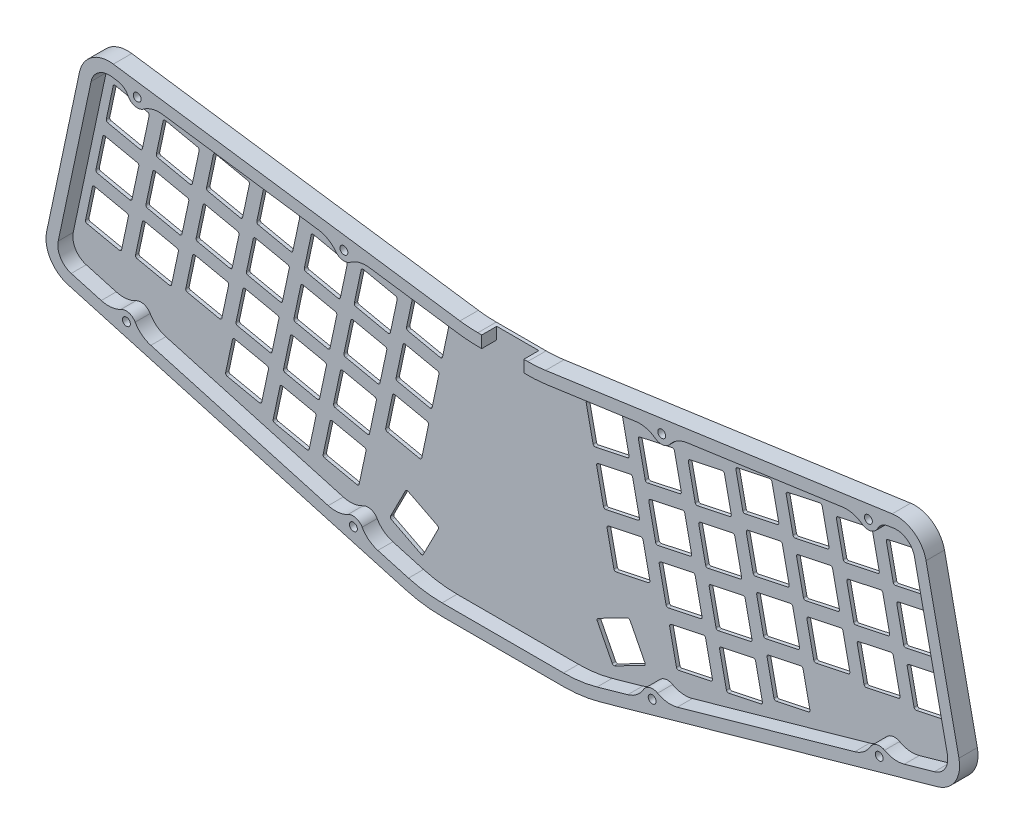
from build123d import *

# Parameters (mm, degrees)
MODEL_R             = 1.5
BOSS_EXTRUDE1_DEPTH = 7
BOSS_EXTRUDE2_DEPTH = 1.3
MODEL_4_R           = 1.5
BOSS_EXTRUDE3_DEPTH = 2
CUT_EXTRUDE1_DEPTH  = 10


with BuildPart() as part:
    # Model → Boss-Extrude1 (new body)
    with BuildSketch(Plane.XY):
        with BuildLine():
            ThreePointArc((176.403737975, 57.612801897), (173.012294783, 57.253677545), (169.603999044, 57.1337718))
            Line((169.603999044, 57.1337718), (150.648829756, 57.1337718))
            ThreePointArc((150.648829756, 57.1337718), (147.240534017, 57.253677545), (143.849090824, 57.612801897))
            Line((143.849090824, 57.612801897), (12.081352867, 76.271030157))
            ThreePointArc((12.081352867, 76.271030157), (3.877804033, 74.308284837), (-0.779653775, 67.275599046))
            Line((-0.779653775, 67.275599046), (-13.274730709, 8.490883588))
            ThreePointArc((-13.274730709, 8.490883588), (-11.871459071, 0.157038619), (-5.151125733, -4.967340667))
            Line((-5.151125733, -4.967340667), (123.055393281, -41.169431628))
            ThreePointArc((123.055393281, -41.169431628), (129.986107868, -42.620640598), (137.050372447, -43.1074446))
            Line((137.050372447, -43.1074446), (183.202456353, -43.1074446))
            ThreePointArc((183.202456353, -43.1074446), (190.266720932, -42.620640598), (197.197435519, -41.169431628))
            Line((197.197435519, -41.169431628), (325.403954533, -4.967340667))
            ThreePointArc((325.403954533, -4.967340667), (332.124287871, 0.157038619), (333.527559509, 8.490883588))
            Line((333.527559509, 8.490883588), (321.032482575, 67.275599045))
            ThreePointArc((321.032482575, 67.275599045), (316.375024767, 74.308284836), (308.171475933, 76.271030156))
            Line((308.171475933, 76.271030156), (176.403737975, 57.612801897))
        make_face()
        with Locations((103.335575354, -30.405568574)):
            Circle(MODEL_R, mode=Mode.SUBTRACT)
        with Locations((17.039281052, -6.037803815)):
            Circle(MODEL_R, mode=Mode.SUBTRACT)
        with Locations((216.917253446, -30.405568574)):
            Circle(MODEL_R, mode=Mode.SUBTRACT)
        with Locations((303.213547748, -6.037803815)):
            Circle(MODEL_R, mode=Mode.SUBTRACT)
        with Locations((21.146353911, 69.937554571)):
            Circle(MODEL_R, mode=Mode.SUBTRACT)
        with Locations((99.718342652, 58.811810716)):
            Circle(MODEL_R, mode=Mode.SUBTRACT)
        with BuildLine():
            Line((124.278255538, -36.838772567), (112.628950613, -33.549320519))
            ThreePointArc((112.628950613, -33.549320519), (109.193120681, -31.80832864), (106.670193349, -28.897861715))
            ThreePointArc((106.670193349, -28.897861715), (104.286690443, -27.037278193), (101.282051153, -27.376394512))
            ThreePointArc((101.282051153, -27.376394512), (97.609446415, -28.537408934), (93.770452927, -28.224185309))
            Line((93.770452927, -28.224185309), (26.332656311, -9.18155576))
            ThreePointArc((26.332656311, -9.18155576), (22.896826379, -7.440563881), (20.373899046, -4.530096956))
            ThreePointArc((20.373899046, -4.530096956), (17.99039614, -2.669513434), (14.98575685, -3.008629753))
            ThreePointArc((14.98575685, -3.008629753), (11.313152113, -4.169644175), (7.474158624, -3.85642055))
            Line((7.474158624, -3.85642055), (-3.928263476, -0.636681606))
            ThreePointArc((-3.928263476, -0.636681606), (-8.01890116, 2.482505785), (-8.873066505, 7.555280983))
            Line((-8.873066505, 7.555280983), (3.622010429, 66.339996442))
            ThreePointArc((3.622010429, 66.339996442), (6.456984747, 70.620761706), (11.450449255, 71.815476249))
            Line((11.450449255, 71.815476249), (13.807051559, 71.481782855))
            ThreePointArc((13.807051559, 71.481782855), (16.05801748, 70.566743382), (17.611829082, 68.698638909))
            ThreePointArc((17.611829082, 68.698638909), (20.250303311, 66.551050421), (23.587647853, 67.21121251))
            ThreePointArc((23.587647853, 67.21121251), (27.071325394, 68.854371308), (30.917639732, 69.058934404))
            Line((30.917639732, 69.058934404), (90.087257633, 60.680553975))
            ThreePointArc((90.087257633, 60.680553975), (93.725570339, 59.416172428), (96.616102068, 56.870429634))
            ThreePointArc((96.616102068, 56.870429634), (99.227639842, 55.346379898), (102.159636594, 56.085468655))
            ThreePointArc((102.159636594, 56.085468655), (105.643314135, 57.728627453), (109.489628473, 57.933190549))
            Line((109.489628473, 57.933190549), (143.218187212, 53.157247988))
            ThreePointArc((143.218187212, 53.157247988), (146.924300392, 52.76480282), (150.648829756, 52.6337718))
            Line((150.648829756, 52.6337718), (169.603999044, 52.6337718))
            ThreePointArc((169.603999044, 52.6337718), (173.328528408, 52.76480282), (177.034641588, 53.157247988))
            Line((177.034641588, 53.157247988), (210.763200327, 57.933190549))
            ThreePointArc((210.763200327, 57.933190549), (214.609514665, 57.728627453), (218.093192206, 56.085468655))
            ThreePointArc((218.093192206, 56.085468655), (221.025188958, 55.346379898), (223.636726732, 56.870429634))
            ThreePointArc((223.636726732, 56.870429634), (226.52725846, 59.416172428), (230.165571167, 60.680553974))
            Line((230.165571167, 60.680553974), (289.335189068, 69.058934403))
            ThreePointArc((289.335189068, 69.058934403), (293.181503406, 68.854371307), (296.665180948, 67.211212509))
            ThreePointArc((296.665180948, 67.211212509), (300.002525489, 66.55105042), (302.640999718, 68.698638908))
            ThreePointArc((302.640999718, 68.698638908), (304.19481132, 70.566743381), (306.445777241, 71.481782853))
            Line((306.445777241, 71.481782853), (308.802379545, 71.815476247))
            ThreePointArc((308.802379545, 71.815476247), (313.795844053, 70.620761705), (316.630818371, 66.339996441))
            Line((316.630818371, 66.339996441), (329.125895305, 7.555280983))
            ThreePointArc((329.125895305, 7.555280983), (328.27172996, 2.482505785), (324.181092276, -0.636681606))
            Line((324.181092276, -0.636681606), (312.778670176, -3.85642055))
            ThreePointArc((312.778670176, -3.85642055), (308.939676687, -4.169644175), (305.26707195, -3.008629753))
            ThreePointArc((305.26707195, -3.008629753), (302.26243266, -2.669513434), (299.878929754, -4.530096956))
            ThreePointArc((299.878929754, -4.530096956), (297.356002421, -7.440563881), (293.920172489, -9.18155576))
            Line((293.920172489, -9.18155576), (226.482375873, -28.224185309))
            ThreePointArc((226.482375873, -28.224185309), (222.643382385, -28.537408934), (218.970777647, -27.376394512))
            ThreePointArc((218.970777647, -27.376394512), (215.966138357, -27.037278193), (213.582635451, -28.897861715))
            ThreePointArc((213.582635451, -28.897861715), (211.059708119, -31.80832864), (207.623878187, -33.549320519))
            Line((207.623878187, -33.549320519), (195.974573262, -36.838772567))
            ThreePointArc((195.974573262, -36.838772567), (189.649455095, -38.16317687), (183.202456353, -38.6074446))
            Line((183.202456353, -38.6074446), (137.050372447, -38.6074446))
            ThreePointArc((137.050372447, -38.6074446), (130.603373705, -38.16317687), (124.278255538, -36.838772567))
        make_face(mode=Mode.SUBTRACT)
        with Locations((220.534486148, 58.811810716)):
            Circle(MODEL_R, mode=Mode.SUBTRACT)
        with Locations((299.10647489, 69.93755457)):
            Circle(MODEL_R, mode=Mode.SUBTRACT)
    extrude(amount=BOSS_EXTRUDE1_DEPTH)

    # Model<3> → Boss-Extrude2 (add)
    with BuildSketch(Plane.XY):
        with BuildLine():
            ThreePointArc((106.670193349, -28.897861715), (109.193120681, -31.80832864), (112.628950613, -33.549320519))
            Line((112.628950613, -33.549320519), (124.278255538, -36.838772567))
            ThreePointArc((124.278255538, -36.838772567), (130.603373705, -38.16317687), (137.050372447, -38.6074446))
            Line((137.050372447, -38.6074446), (160.1264144, -38.6074446))
            Line((160.1264144, -38.6074446), (183.202456353, -38.6074446))
            ThreePointArc((183.202456353, -38.6074446), (189.649455095, -38.16317687), (195.974573262, -36.838772567))
            Line((195.974573262, -36.838772567), (207.623878187, -33.549320519))
            ThreePointArc((207.623878187, -33.549320519), (211.059708119, -31.80832864), (213.582635451, -28.897861715))
            ThreePointArc((213.582635451, -28.897861715), (215.966138357, -27.037278193), (218.970777647, -27.376394512))
            ThreePointArc((218.970777647, -27.376394512), (222.643382385, -28.537408934), (226.482375873, -28.224185309))
            Line((226.482375873, -28.224185309), (271.948963849, -15.385637267))
            Line((271.948963849, -15.385637267), (293.920172489, -9.18155576))
            ThreePointArc((293.920172489, -9.18155576), (297.356002421, -7.440563881), (299.878929754, -4.530096956))
            ThreePointArc((299.878929754, -4.530096956), (302.26243266, -2.669513434), (305.26707195, -3.008629753))
            ThreePointArc((305.26707195, -3.008629753), (308.939676687, -4.169644175), (312.778670176, -3.85642055))
            Line((312.778670176, -3.85642055), (324.181092276, -0.636681606))
            ThreePointArc((324.181092276, -0.636681606), (328.27172996, 2.482505785), (329.125895305, 7.555280983))
            Line((329.125895305, 7.555280983), (322.378197452, 39.30070363))
            Line((322.378197452, 39.30070363), (316.630818371, 66.339996441))
            ThreePointArc((316.630818371, 66.339996441), (313.795844053, 70.620761705), (308.802379545, 71.815476247))
            Line((308.802379545, 71.815476247), (306.445777241, 71.481782853))
            ThreePointArc((306.445777241, 71.481782853), (304.19481132, 70.566743381), (302.640999718, 68.698638908))
            ThreePointArc((302.640999718, 68.698638908), (300.002525489, 66.55105042), (296.665180948, 67.211212509))
            ThreePointArc((296.665180948, 67.211212509), (293.181503406, 68.854371307), (289.335189068, 69.058934403))
            Line((289.335189068, 69.058934403), (230.165571167, 60.680553974))
            ThreePointArc((230.165571167, 60.680553974), (226.52725846, 59.416172428), (223.636726732, 56.870429634))
            ThreePointArc((223.636726732, 56.870429634), (221.025188958, 55.346379898), (218.093192206, 56.085468655))
            ThreePointArc((218.093192206, 56.085468655), (214.609514665, 57.728627453), (210.763200327, 57.933190549))
            Line((210.763200327, 57.933190549), (177.034641588, 53.157247988))
            ThreePointArc((177.034641588, 53.157247988), (173.328528408, 52.76480282), (169.603999044, 52.6337718))
            Line((169.603999044, 52.6337718), (150.648829756, 52.6337718))
            ThreePointArc((150.648829756, 52.6337718), (146.924300392, 52.76480282), (143.218187212, 53.157247988))
            Line((143.218187212, 53.157247988), (109.489628473, 57.933190549))
            ThreePointArc((109.489628473, 57.933190549), (105.643314135, 57.728627453), (102.159636594, 56.085468655))
            ThreePointArc((102.159636594, 56.085468655), (99.227639842, 55.346379898), (96.616102068, 56.870429634))
            ThreePointArc((96.616102068, 56.870429634), (93.725570339, 59.416172428), (90.087257633, 60.680553975))
            Line((90.087257633, 60.680553975), (30.917639732, 69.058934404))
            ThreePointArc((30.917639732, 69.058934404), (27.071325394, 68.854371308), (23.587647853, 67.21121251))
            ThreePointArc((23.587647853, 67.21121251), (20.250303311, 66.551050421), (17.611829082, 68.698638909))
            ThreePointArc((17.611829082, 68.698638909), (16.05801748, 70.566743382), (13.807051559, 71.481782855))
            Line((13.807051559, 71.481782855), (11.450449255, 71.815476249))
            ThreePointArc((11.450449255, 71.815476249), (6.456984747, 70.620761706), (3.622010429, 66.339996442))
            Line((3.622010429, 66.339996442), (-2.125368652, 39.30070363))
            Line((-2.125368652, 39.30070363), (-8.873066505, 7.555280983))
            ThreePointArc((-8.873066505, 7.555280983), (-8.01890116, 2.482505785), (-3.928263476, -0.636681606))
            Line((-3.928263476, -0.636681606), (7.474158624, -3.85642055))
            ThreePointArc((7.474158624, -3.85642055), (11.313152113, -4.169644175), (14.98575685, -3.008629753))
            ThreePointArc((14.98575685, -3.008629753), (17.99039614, -2.669513434), (20.373899046, -4.530096956))
            ThreePointArc((20.373899046, -4.530096956), (22.896826379, -7.440563881), (26.332656311, -9.18155576))
            Line((26.332656311, -9.18155576), (48.303864951, -15.385637267))
            Line((48.303864951, -15.385637267), (93.770452927, -28.224185309))
            ThreePointArc((93.770452927, -28.224185309), (97.609446415, -28.537408934), (101.282051153, -27.376394512))
            ThreePointArc((101.282051153, -27.376394512), (104.286690443, -27.037278193), (106.670193349, -28.897861715))
        make_face()
        with BuildLine():
            ThreePointArc((88.727862955, -5.824846865), (89.052994379, -5.351777707), (89.617407423, -5.247169932))
            Line((89.617407423, -5.247169932), (101.844252435, -7.846066055))
            ThreePointArc((101.844252435, -7.846066055), (102.317321593, -8.171197479), (102.421929368, -8.735610523))
            Line((102.421929368, -8.735610523), (99.823033245, -20.962455535))
            ThreePointArc((99.823033245, -20.962455535), (99.497901821, -21.435524693), (98.933488777, -21.540132468))
            Line((98.933488777, -21.540132468), (86.706643765, -18.941236345))
            ThreePointArc((86.706643765, -18.941236345), (86.233574607, -18.616104921), (86.128966832, -18.051691877))
            Line((86.128966832, -18.051691877), (88.727862955, -5.824846865))
        make_face(mode=Mode.SUBTRACT)
        with BuildLine():
            Line((123.222791405, -32.202255303), (117.65400063, -29.364814683))
            Line((117.65400063, -29.364814683), (112.08520985, -26.527374062))
            ThreePointArc((112.08520985, -26.527374062), (111.712410337, -26.090881916), (111.75744783, -25.518626297))
            Line((111.75744783, -25.518626297), (117.432329033, -14.381044722))
            ThreePointArc((117.432329033, -14.381044722), (117.86882118, -14.008245208), (118.441076802, -14.053282701))
            Line((118.441076802, -14.053282701), (129.578658358, -19.728163942))
            ThreePointArc((129.578658358, -19.728163942), (129.95145787, -20.164656088), (129.906420378, -20.736911707))
            Line((129.906420378, -20.736911707), (124.231539174, -31.874493282))
            ThreePointArc((124.231539174, -31.874493282), (123.795047027, -32.247292796), (123.222791405, -32.202255303))
        make_face(mode=Mode.SUBTRACT)
        with BuildLine():
            ThreePointArc((51.662209955, 2.564871135), (51.987341379, 3.037940293), (52.551754423, 3.142548068))
            Line((52.551754423, 3.142548068), (64.778599435, 0.543651945))
            ThreePointArc((64.778599435, 0.543651945), (65.251668593, 0.218520521), (65.356276368, -0.345892523))
            Line((65.356276368, -0.345892523), (62.757380245, -12.572737535))
            ThreePointArc((62.757380245, -12.572737535), (62.432248821, -13.045806693), (61.867835777, -13.150414468))
            Line((61.867835777, -13.150414468), (49.640990765, -10.551518345))
            ThreePointArc((49.640990765, -10.551518345), (49.167921607, -10.226386921), (49.063313832, -9.661973877))
            Line((49.063313832, -9.661973877), (51.662209955, 2.564871135))
        make_face(mode=Mode.SUBTRACT)
        with BuildLine():
            ThreePointArc((17.403364705, 24.159581835), (17.728496129, 24.632650993), (18.292909173, 24.737258768))
            Line((18.292909173, 24.737258768), (30.519754185, 22.138362645))
            ThreePointArc((30.519754185, 22.138362645), (30.992823343, 21.813231221), (31.097431118, 21.248818177))
            Line((31.097431118, 21.248818177), (28.498534995, 9.021973165))
            ThreePointArc((28.498534995, 9.021973165), (28.173403571, 8.548904007), (27.608990527, 8.444296232))
            Line((27.608990527, 8.444296232), (15.382145515, 11.043192355))
            ThreePointArc((15.382145515, 11.043192355), (14.909076357, 11.368323779), (14.804468582, 11.932736823))
            Line((14.804468582, 11.932736823), (17.403364705, 24.159581835))
        make_face(mode=Mode.SUBTRACT)
        with BuildLine():
            ThreePointArc((36.507948405, 22.654628735), (36.833079829, 23.127697893), (37.397492873, 23.232305668))
            Line((37.397492873, 23.232305668), (49.624337885, 20.633409545))
            ThreePointArc((49.624337885, 20.633409545), (50.097407043, 20.308278121), (50.202014818, 19.743865077))
            Line((50.202014818, 19.743865077), (47.603118695, 7.517020065))
            ThreePointArc((47.603118695, 7.517020065), (47.277987271, 7.043950907), (46.713574227, 6.939343132))
            Line((46.713574227, 6.939343132), (34.486729215, 9.538239255))
            ThreePointArc((34.486729215, 9.538239255), (34.013660057, 9.863370679), (33.909052282, 10.427783723))
            Line((33.909052282, 10.427783723), (36.507948405, 22.654628735))
        make_face(mode=Mode.SUBTRACT)
        with BuildLine():
            ThreePointArc((55.612532005, 21.149675635), (55.937663429, 21.622744793), (56.502076473, 21.727352568))
            Line((56.502076473, 21.727352568), (68.728921485, 19.128456445))
            ThreePointArc((68.728921485, 19.128456445), (69.201990643, 18.803325021), (69.306598418, 18.238911977))
            Line((69.306598418, 18.238911977), (66.707702295, 6.012066965))
            ThreePointArc((66.707702295, 6.012066965), (66.382570871, 5.538997807), (65.818157827, 5.434390032))
            Line((65.818157827, 5.434390032), (53.591312815, 8.033286155))
            ThreePointArc((53.591312815, 8.033286155), (53.118243657, 8.358417579), (53.013635882, 8.922830623))
            Line((53.013635882, 8.922830623), (55.612532005, 21.149675635))
        make_face(mode=Mode.SUBTRACT)
        with BuildLine():
            ThreePointArc((69.727235155, -3.830819965), (70.052366579, -3.357750807), (70.616779623, -3.253143032))
            Line((70.616779623, -3.253143032), (82.843624635, -5.852039155))
            ThreePointArc((82.843624635, -5.852039155), (83.316693793, -6.177170579), (83.421301568, -6.741583623))
            Line((83.421301568, -6.741583623), (80.822405445, -18.968428635))
            ThreePointArc((80.822405445, -18.968428635), (80.497274021, -19.441497793), (79.932860977, -19.546105568))
            Line((79.932860977, -19.546105568), (67.706015965, -16.947209445))
            ThreePointArc((67.706015965, -16.947209445), (67.232946807, -16.622078021), (67.128339032, -16.057664977))
            Line((67.128339032, -16.057664977), (69.727235155, -3.830819965))
        make_face(mode=Mode.SUBTRACT)
        with BuildLine():
            ThreePointArc((73.677557205, 14.753984435), (74.002688629, 15.227053593), (74.567101673, 15.331661368))
            Line((74.567101673, 15.331661368), (86.793946685, 12.732765245))
            ThreePointArc((86.793946685, 12.732765245), (87.267015843, 12.407633821), (87.371623618, 11.843220777))
            Line((87.371623618, 11.843220777), (84.772727495, -0.383624235))
            ThreePointArc((84.772727495, -0.383624235), (84.447596071, -0.856693393), (83.883183027, -0.961301168))
            Line((83.883183027, -0.961301168), (71.656338015, 1.637594955))
            ThreePointArc((71.656338015, 1.637594955), (71.183268857, 1.962726379), (71.078661082, 2.527139423))
            Line((71.078661082, 2.527139423), (73.677557205, 14.753984435))
        make_face(mode=Mode.SUBTRACT)
        with BuildLine():
            ThreePointArc((92.678185005, 12.759957535), (93.003316429, 13.233026693), (93.567729473, 13.337634468))
            Line((93.567729473, 13.337634468), (105.794574485, 10.738738345))
            ThreePointArc((105.794574485, 10.738738345), (106.267643643, 10.413606921), (106.372251418, 9.849193877))
            Line((106.372251418, 9.849193877), (103.773355295, -2.377651135))
            ThreePointArc((103.773355295, -2.377651135), (103.448223871, -2.850720293), (102.883810827, -2.955328068))
            Line((102.883810827, -2.955328068), (90.656965815, -0.356431945))
            ThreePointArc((90.656965815, -0.356431945), (90.183896657, -0.031300521), (90.079288882, 0.533112523))
            Line((90.079288882, 0.533112523), (92.678185005, 12.759957535))
        make_face(mode=Mode.SUBTRACT)
        with BuildLine():
            ThreePointArc((112.510459605, 14.678521035), (112.835591029, 15.151590193), (113.400004073, 15.256197968))
            Line((113.400004073, 15.256197968), (125.626849085, 12.657301845))
            ThreePointArc((125.626849085, 12.657301845), (126.099918243, 12.332170421), (126.204526018, 11.767757377))
            Line((126.204526018, 11.767757377), (123.605629895, -0.459087635))
            ThreePointArc((123.605629895, -0.459087635), (123.280498471, -0.932156793), (122.716085427, -1.036764568))
            Line((122.716085427, -1.036764568), (110.489240415, 1.562131555))
            ThreePointArc((110.489240415, 1.562131555), (110.016171257, 1.887262979), (109.911563482, 2.451676023))
            Line((109.911563482, 2.451676023), (112.510459605, 14.678521035))
        make_face(mode=Mode.SUBTRACT)
        with BuildLine():
            Line((208.16761895, -26.527374062), (202.59882817, -29.364814683))
            Line((202.59882817, -29.364814683), (197.030037395, -32.202255303))
            ThreePointArc((197.030037395, -32.202255303), (196.457781773, -32.247292796), (196.021289626, -31.874493282))
            Line((196.021289626, -31.874493282), (190.346408422, -20.736911707))
            ThreePointArc((190.346408422, -20.736911707), (190.30137093, -20.164656088), (190.674170442, -19.728163942))
            Line((190.674170442, -19.728163942), (201.811751998, -14.053282701))
            ThreePointArc((201.811751998, -14.053282701), (202.38400762, -14.008245208), (202.820499767, -14.381044722))
            Line((202.820499767, -14.381044722), (208.49538097, -25.518626297))
            ThreePointArc((208.49538097, -25.518626297), (208.540418463, -26.090881916), (208.16761895, -26.527374062))
        make_face(mode=Mode.SUBTRACT)
        with BuildLine():
            Line((218.408576365, -7.846066055), (230.635421377, -5.247169932))
            ThreePointArc((230.635421377, -5.247169932), (231.199834421, -5.351777707), (231.524965845, -5.824846865))
            Line((231.524965845, -5.824846865), (234.123861968, -18.051691877))
            ThreePointArc((234.123861968, -18.051691877), (234.019254193, -18.616104921), (233.546185035, -18.941236345))
            Line((233.546185035, -18.941236345), (221.319340023, -21.540132468))
            ThreePointArc((221.319340023, -21.540132468), (220.754926979, -21.435524693), (220.429795555, -20.962455535))
            Line((220.429795555, -20.962455535), (217.830899432, -8.735610523))
            ThreePointArc((217.830899432, -8.735610523), (217.935507207, -8.171197479), (218.408576365, -7.846066055))
        make_face(mode=Mode.SUBTRACT)
        with BuildLine():
            Line((237.409204165, -5.852039155), (249.636049177, -3.253143032))
            ThreePointArc((249.636049177, -3.253143032), (250.200462221, -3.357750807), (250.525593645, -3.830819965))
            Line((250.525593645, -3.830819965), (253.124489768, -16.057664977))
            ThreePointArc((253.124489768, -16.057664977), (253.019881993, -16.622078021), (252.546812835, -16.947209445))
            Line((252.546812835, -16.947209445), (240.319967823, -19.546105568))
            ThreePointArc((240.319967823, -19.546105568), (239.755554779, -19.441497793), (239.430423355, -18.968428635))
            Line((239.430423355, -18.968428635), (236.831527232, -6.741583623))
            ThreePointArc((236.831527232, -6.741583623), (236.936135007, -6.177170579), (237.409204165, -5.852039155))
        make_face(mode=Mode.SUBTRACT)
        with BuildLine():
            Line((194.625979715, 12.657301845), (206.852824727, 15.256197968))
            ThreePointArc((206.852824727, 15.256197968), (207.417237771, 15.151590193), (207.742369195, 14.678521035))
            Line((207.742369195, 14.678521035), (210.341265318, 2.451676023))
            ThreePointArc((210.341265318, 2.451676023), (210.236657543, 1.887262979), (209.763588385, 1.562131555))
            Line((209.763588385, 1.562131555), (197.536743373, -1.036764568))
            ThreePointArc((197.536743373, -1.036764568), (196.972330329, -0.932156793), (196.647198905, -0.459087635))
            Line((196.647198905, -0.459087635), (194.048302782, 11.767757377))
            ThreePointArc((194.048302782, 11.767757377), (194.152910557, 12.332170421), (194.625979715, 12.657301845))
        make_face(mode=Mode.SUBTRACT)
        with BuildLine():
            Line((214.458254315, 10.738738345), (226.685099327, 13.337634468))
            ThreePointArc((226.685099327, 13.337634468), (227.249512371, 13.233026693), (227.574643795, 12.759957535))
            Line((227.574643795, 12.759957535), (230.173539918, 0.533112523))
            ThreePointArc((230.173539918, 0.533112523), (230.068932143, -0.031300521), (229.595862985, -0.356431945))
            Line((229.595862985, -0.356431945), (217.369017973, -2.955328068))
            ThreePointArc((217.369017973, -2.955328068), (216.804604929, -2.850720293), (216.479473505, -2.377651135))
            Line((216.479473505, -2.377651135), (213.880577382, 9.849193877))
            ThreePointArc((213.880577382, 9.849193877), (213.985185157, 10.413606921), (214.458254315, 10.738738345))
        make_face(mode=Mode.SUBTRACT)
        with BuildLine():
            Line((233.458882115, 12.732765245), (245.685727127, 15.331661368))
            ThreePointArc((245.685727127, 15.331661368), (246.250140171, 15.227053593), (246.575271595, 14.753984435))
            Line((246.575271595, 14.753984435), (249.174167718, 2.527139423))
            ThreePointArc((249.174167718, 2.527139423), (249.069559943, 1.962726379), (248.596490785, 1.637594955))
            Line((248.596490785, 1.637594955), (236.369645773, -0.961301168))
            ThreePointArc((236.369645773, -0.961301168), (235.805232729, -0.856693393), (235.480101305, -0.383624235))
            Line((235.480101305, -0.383624235), (232.881205182, 11.843220777))
            ThreePointArc((232.881205182, 11.843220777), (232.985812957, 12.407633821), (233.458882115, 12.732765245))
        make_face(mode=Mode.SUBTRACT)
        with BuildLine():
            Line((255.474229365, 0.543651945), (267.701074377, 3.142548068))
            ThreePointArc((267.701074377, 3.142548068), (268.265487421, 3.037940293), (268.590618845, 2.564871135))
            Line((268.590618845, 2.564871135), (271.189514968, -9.661973877))
            ThreePointArc((271.189514968, -9.661973877), (271.084907193, -10.226386921), (270.611838035, -10.551518345))
            Line((270.611838035, -10.551518345), (258.384993023, -13.150414468))
            ThreePointArc((258.384993023, -13.150414468), (257.820579979, -13.045806693), (257.495448555, -12.572737535))
            Line((257.495448555, -12.572737535), (254.896552432, -0.345892523))
            ThreePointArc((254.896552432, -0.345892523), (255.001160207, 0.218520521), (255.474229365, 0.543651945))
        make_face(mode=Mode.SUBTRACT)
        with BuildLine():
            Line((251.523907315, 19.128456445), (263.750752327, 21.727352568))
            ThreePointArc((263.750752327, 21.727352568), (264.315165371, 21.622744793), (264.640296795, 21.149675635))
            Line((264.640296795, 21.149675635), (267.239192918, 8.922830623))
            ThreePointArc((267.239192918, 8.922830623), (267.134585143, 8.358417579), (266.661515985, 8.033286155))
            Line((266.661515985, 8.033286155), (254.434670973, 5.434390032))
            ThreePointArc((254.434670973, 5.434390032), (253.870257929, 5.538997807), (253.545126505, 6.012066965))
            Line((253.545126505, 6.012066965), (250.946230382, 18.238911977))
            ThreePointArc((250.946230382, 18.238911977), (251.050838157, 18.803325021), (251.523907315, 19.128456445))
        make_face(mode=Mode.SUBTRACT)
        with BuildLine():
            Line((270.628490915, 20.633409545), (282.855335927, 23.232305668))
            ThreePointArc((282.855335927, 23.232305668), (283.419748971, 23.127697893), (283.744880395, 22.654628735))
            Line((283.744880395, 22.654628735), (286.343776518, 10.427783723))
            ThreePointArc((286.343776518, 10.427783723), (286.239168743, 9.863370679), (285.766099585, 9.538239255))
            Line((285.766099585, 9.538239255), (273.539254573, 6.939343132))
            ThreePointArc((273.539254573, 6.939343132), (272.974841529, 7.043950907), (272.649710105, 7.517020065))
            Line((272.649710105, 7.517020065), (270.050813982, 19.743865077))
            ThreePointArc((270.050813982, 19.743865077), (270.155421757, 20.308278121), (270.628490915, 20.633409545))
        make_face(mode=Mode.SUBTRACT)
        with BuildLine():
            Line((289.733074615, 22.138362645), (301.959919627, 24.737258768))
            ThreePointArc((301.959919627, 24.737258768), (302.524332671, 24.632650993), (302.849464095, 24.159581835))
            Line((302.849464095, 24.159581835), (305.448360218, 11.932736823))
            ThreePointArc((305.448360218, 11.932736823), (305.343752443, 11.368323779), (304.870683285, 11.043192355))
            Line((304.870683285, 11.043192355), (292.643838273, 8.444296232))
            ThreePointArc((292.643838273, 8.444296232), (292.079425229, 8.548904007), (291.754293805, 9.021973165))
            Line((291.754293805, 9.021973165), (289.155397682, 21.248818177))
            ThreePointArc((289.155397682, 21.248818177), (289.260005457, 21.813231221), (289.733074615, 22.138362645))
        make_face(mode=Mode.SUBTRACT)
        with BuildLine():
            ThreePointArc((-1.597263045, 26.153608735), (-1.272131621, 26.626677893), (-0.707718577, 26.731285668))
            Line((-0.707718577, 26.731285668), (11.519126435, 24.132389545))
            ThreePointArc((11.519126435, 24.132389545), (11.992195593, 23.807258121), (12.096803368, 23.242845077))
            Line((12.096803368, 23.242845077), (9.497907245, 11.016000065))
            ThreePointArc((9.497907245, 11.016000065), (9.172775821, 10.542930907), (8.608362777, 10.438323132))
            Line((8.608362777, 10.438323132), (-3.618482235, 13.037219255))
            ThreePointArc((-3.618482235, 13.037219255), (-4.091551393, 13.362350679), (-4.196159168, 13.926763723))
            Line((-4.196159168, 13.926763723), (-1.597263045, 26.153608735))
        make_face(mode=Mode.SUBTRACT)
        with BuildLine():
            ThreePointArc((2.353059155, 44.738413135), (2.678190579, 45.211482293), (3.242603623, 45.316090068))
            Line((3.242603623, 45.316090068), (15.469448635, 42.717193945))
            ThreePointArc((15.469448635, 42.717193945), (15.942517793, 42.392062521), (16.047125568, 41.827649477))
            Line((16.047125568, 41.827649477), (13.448229445, 29.600804465))
            ThreePointArc((13.448229445, 29.600804465), (13.123098021, 29.127735307), (12.558684977, 29.023127532))
            Line((12.558684977, 29.023127532), (0.331839965, 31.622023655))
            ThreePointArc((0.331839965, 31.622023655), (-0.141229193, 31.947155079), (-0.245836968, 32.511568123))
            Line((-0.245836968, 32.511568123), (2.353059155, 44.738413135))
        make_face(mode=Mode.SUBTRACT)
        with BuildLine():
            ThreePointArc((21.353686905, 42.744386235), (21.678818329, 43.217455393), (22.243231373, 43.322063168))
            Line((22.243231373, 43.322063168), (34.470076385, 40.723167045))
            ThreePointArc((34.470076385, 40.723167045), (34.943145543, 40.398035621), (35.047753318, 39.833622577))
            Line((35.047753318, 39.833622577), (32.448857195, 27.606777565))
            ThreePointArc((32.448857195, 27.606777565), (32.123725771, 27.133708407), (31.559312727, 27.029100632))
            Line((31.559312727, 27.029100632), (19.332467715, 29.627996755))
            ThreePointArc((19.332467715, 29.627996755), (18.859398557, 29.953128179), (18.754790782, 30.517541223))
            Line((18.754790782, 30.517541223), (21.353686905, 42.744386235))
        make_face(mode=Mode.SUBTRACT)
        with BuildLine():
            ThreePointArc((40.458270605, 41.239433135), (40.783402029, 41.712502293), (41.347815073, 41.817110068))
            Line((41.347815073, 41.817110068), (53.574660085, 39.218213945))
            ThreePointArc((53.574660085, 39.218213945), (54.047729243, 38.893082521), (54.152337018, 38.328669477))
            Line((54.152337018, 38.328669477), (51.553440895, 26.101824465))
            ThreePointArc((51.553440895, 26.101824465), (51.228309471, 25.628755307), (50.663896427, 25.524147532))
            Line((50.663896427, 25.524147532), (38.437051415, 28.123043655))
            ThreePointArc((38.437051415, 28.123043655), (37.963982257, 28.448175079), (37.859374482, 29.012588123))
            Line((37.859374482, 29.012588123), (40.458270605, 41.239433135))
        make_face(mode=Mode.SUBTRACT)
        with BuildLine():
            ThreePointArc((59.562854205, 39.734480035), (59.887985629, 40.207549193), (60.452398673, 40.312156968))
            Line((60.452398673, 40.312156968), (72.679243685, 37.713260845))
            ThreePointArc((72.679243685, 37.713260845), (73.152312843, 37.388129421), (73.256920618, 36.823716377))
            Line((73.256920618, 36.823716377), (70.658024495, 24.596871365))
            ThreePointArc((70.658024495, 24.596871365), (70.332893071, 24.123802207), (69.768480027, 24.019194432))
            Line((69.768480027, 24.019194432), (57.541635015, 26.618090555))
            ThreePointArc((57.541635015, 26.618090555), (57.068565857, 26.943221979), (56.963958082, 27.507635023))
            Line((56.963958082, 27.507635023), (59.562854205, 39.734480035))
        make_face(mode=Mode.SUBTRACT)
        with BuildLine():
            ThreePointArc((96.628507205, 31.344761935), (96.953638629, 31.817831093), (97.518051673, 31.922438868))
            Line((97.518051673, 31.922438868), (109.744896685, 29.323542745))
            ThreePointArc((109.744896685, 29.323542745), (110.217965843, 28.998411321), (110.322573618, 28.433998277))
            Line((110.322573618, 28.433998277), (107.723677495, 16.207153265))
            ThreePointArc((107.723677495, 16.207153265), (107.398546071, 15.734084107), (106.834133027, 15.629476332))
            Line((106.834133027, 15.629476332), (94.607288015, 18.228372455))
            ThreePointArc((94.607288015, 18.228372455), (94.134218857, 18.553503879), (94.029611082, 19.117916923))
            Line((94.029611082, 19.117916923), (96.628507205, 31.344761935))
        make_face(mode=Mode.SUBTRACT)
        with BuildLine():
            ThreePointArc((77.627879405, 33.338788835), (77.953010829, 33.811857993), (78.517423873, 33.916465768))
            Line((78.517423873, 33.916465768), (90.744268885, 31.317569645))
            ThreePointArc((90.744268885, 31.317569645), (91.217338043, 30.992438221), (91.321945818, 30.428025177))
            Line((91.321945818, 30.428025177), (88.723049695, 18.201180165))
            ThreePointArc((88.723049695, 18.201180165), (88.397918271, 17.728111007), (87.833505227, 17.623503232))
            Line((87.833505227, 17.623503232), (75.606660215, 20.222399355))
            ThreePointArc((75.606660215, 20.222399355), (75.133591057, 20.547530779), (75.028983282, 21.111943823))
            Line((75.028983282, 21.111943823), (77.627879405, 33.338788835))
        make_face(mode=Mode.SUBTRACT)
        with BuildLine():
            ThreePointArc((116.460781805, 33.263325435), (116.785913229, 33.736394593), (117.350326273, 33.841002368))
            Line((117.350326273, 33.841002368), (129.577171285, 31.242106245))
            ThreePointArc((129.577171285, 31.242106245), (130.050240443, 30.916974821), (130.154848218, 30.352561777))
            Line((130.154848218, 30.352561777), (127.555952095, 18.125716765))
            ThreePointArc((127.555952095, 18.125716765), (127.230820671, 17.652647607), (126.666407627, 17.548039832))
            Line((126.666407627, 17.548039832), (114.439562615, 20.146935955))
            ThreePointArc((114.439562615, 20.146935955), (113.966493457, 20.472067379), (113.861885682, 21.036480423))
            Line((113.861885682, 21.036480423), (116.460781805, 33.263325435))
        make_face(mode=Mode.SUBTRACT)
        with BuildLine():
            ThreePointArc((81.578201505, 51.923593235), (81.903332929, 52.396662393), (82.467745973, 52.501270168))
            Line((82.467745973, 52.501270168), (94.694590985, 49.902374045))
            ThreePointArc((94.694590985, 49.902374045), (95.167660143, 49.577242621), (95.272267918, 49.012829577))
            Line((95.272267918, 49.012829577), (92.673371795, 36.785984565))
            ThreePointArc((92.673371795, 36.785984565), (92.348240371, 36.312915407), (91.783827327, 36.208307632))
            Line((91.783827327, 36.208307632), (79.556982315, 38.807203755))
            ThreePointArc((79.556982315, 38.807203755), (79.083913157, 39.132335179), (78.979305382, 39.696748223))
            Line((78.979305382, 39.696748223), (81.578201505, 51.923593235))
        make_face(mode=Mode.SUBTRACT)
        with BuildLine():
            ThreePointArc((100.578829305, 49.929566335), (100.903960729, 50.402635493), (101.468373773, 50.507243268))
            Line((101.468373773, 50.507243268), (113.695218785, 47.908347145))
            ThreePointArc((113.695218785, 47.908347145), (114.168287943, 47.583215721), (114.272895718, 47.018802677))
            Line((114.272895718, 47.018802677), (111.673999595, 34.791957665))
            ThreePointArc((111.673999595, 34.791957665), (111.348868171, 34.318888507), (110.784455127, 34.214280732))
            Line((110.784455127, 34.214280732), (98.557610115, 36.813176855))
            ThreePointArc((98.557610115, 36.813176855), (98.084540957, 37.138308279), (97.979933182, 37.702721323))
            Line((97.979933182, 37.702721323), (100.578829305, 49.929566335))
        make_face(mode=Mode.SUBTRACT)
        with BuildLine():
            ThreePointArc((133.527493385, 49.826910645), (134.000562543, 49.501779221), (134.105170318, 48.937366177))
            Line((134.105170318, 48.937366177), (131.506274195, 36.710521165))
            ThreePointArc((131.506274195, 36.710521165), (131.181142771, 36.237452007), (130.616729727, 36.132844232))
            Line((130.616729727, 36.132844232), (118.389884715, 38.731740355))
            ThreePointArc((118.389884715, 38.731740355), (117.916815557, 39.056871779), (117.812207782, 39.621284823))
            Line((117.812207782, 39.621284823), (120.411103905, 51.848129835))
            ThreePointArc((120.411103905, 51.848129835), (120.736235329, 52.321198993), (121.300648373, 52.425806768))
            Line((121.300648373, 52.425806768), (133.527493385, 49.826910645))
        make_face(mode=Mode.SUBTRACT)
        with BuildLine():
            ThreePointArc((6.303381255, 63.323217535), (6.628512679, 63.796286693), (7.192925723, 63.900894468))
            Line((7.192925723, 63.900894468), (19.419770735, 61.301998345))
            ThreePointArc((19.419770735, 61.301998345), (19.892839893, 60.976866921), (19.997447668, 60.412453877))
            Line((19.997447668, 60.412453877), (17.398551545, 48.185608865))
            ThreePointArc((17.398551545, 48.185608865), (17.073420121, 47.712539707), (16.509007077, 47.607931932))
            Line((16.509007077, 47.607931932), (4.282162065, 50.206828055))
            ThreePointArc((4.282162065, 50.206828055), (3.809092907, 50.531959479), (3.704485132, 51.096372523))
            Line((3.704485132, 51.096372523), (6.303381255, 63.323217535))
        make_face(mode=Mode.SUBTRACT)
        with BuildLine():
            ThreePointArc((25.304009005, 61.329190635), (25.629140429, 61.802259793), (26.193553473, 61.906867568))
            Line((26.193553473, 61.906867568), (38.420398485, 59.307971445))
            ThreePointArc((38.420398485, 59.307971445), (38.893467643, 58.982840021), (38.998075418, 58.418426977))
            Line((38.998075418, 58.418426977), (36.399179295, 46.191581965))
            ThreePointArc((36.399179295, 46.191581965), (36.074047871, 45.718512807), (35.509634827, 45.613905032))
            Line((35.509634827, 45.613905032), (23.282789815, 48.212801155))
            ThreePointArc((23.282789815, 48.212801155), (22.809720657, 48.537932579), (22.705112882, 49.102345623))
            Line((22.705112882, 49.102345623), (25.304009005, 61.329190635))
        make_face(mode=Mode.SUBTRACT)
        with BuildLine():
            ThreePointArc((44.408592705, 59.824237535), (44.733724129, 60.297306693), (45.298137173, 60.401914468))
            Line((45.298137173, 60.401914468), (57.524982185, 57.803018345))
            ThreePointArc((57.524982185, 57.803018345), (57.998051343, 57.477886921), (58.102659118, 56.913473877))
            Line((58.102659118, 56.913473877), (55.503762995, 44.686628865))
            ThreePointArc((55.503762995, 44.686628865), (55.178631571, 44.213559707), (54.614218527, 44.108951932))
            Line((54.614218527, 44.108951932), (42.387373515, 46.707848055))
            ThreePointArc((42.387373515, 46.707848055), (41.914304357, 47.032979479), (41.809696582, 47.597392523))
            Line((41.809696582, 47.597392523), (44.408592705, 59.824237535))
        make_face(mode=Mode.SUBTRACT)
        with BuildLine():
            ThreePointArc((63.513176305, 58.319284435), (63.838307729, 58.792353593), (64.402720773, 58.896961368))
            Line((64.402720773, 58.896961368), (76.629565785, 56.298065245))
            ThreePointArc((76.629565785, 56.298065245), (77.102634943, 55.972933821), (77.207242718, 55.408520777))
            Line((77.207242718, 55.408520777), (74.608346595, 43.181675765))
            ThreePointArc((74.608346595, 43.181675765), (74.283215171, 42.708606607), (73.718802127, 42.603998832))
            Line((73.718802127, 42.603998832), (61.491957115, 45.202894955))
            ThreePointArc((61.491957115, 45.202894955), (61.018887957, 45.528026379), (60.914280182, 46.092439423))
            Line((60.914280182, 46.092439423), (63.513176305, 58.319284435))
        make_face(mode=Mode.SUBTRACT)
        with BuildLine():
            Line((190.675657515, 31.242106245), (202.902502527, 33.841002368))
            ThreePointArc((202.902502527, 33.841002368), (203.466915571, 33.736394593), (203.792046995, 33.263325435))
            Line((203.792046995, 33.263325435), (206.390943118, 21.036480423))
            ThreePointArc((206.390943118, 21.036480423), (206.286335343, 20.472067379), (205.813266185, 20.146935955))
            Line((205.813266185, 20.146935955), (193.586421173, 17.548039832))
            ThreePointArc((193.586421173, 17.548039832), (193.022008129, 17.652647607), (192.696876705, 18.125716765))
            Line((192.696876705, 18.125716765), (190.097980582, 30.352561777))
            ThreePointArc((190.097980582, 30.352561777), (190.202588357, 30.916974821), (190.675657515, 31.242106245))
        make_face(mode=Mode.SUBTRACT)
        with BuildLine():
            Line((210.507932115, 29.323542745), (222.734777127, 31.922438868))
            ThreePointArc((222.734777127, 31.922438868), (223.299190171, 31.817831093), (223.624321595, 31.344761935))
            Line((223.624321595, 31.344761935), (226.223217718, 19.117916923))
            ThreePointArc((226.223217718, 19.117916923), (226.118609943, 18.553503879), (225.645540785, 18.228372455))
            Line((225.645540785, 18.228372455), (213.418695773, 15.629476332))
            ThreePointArc((213.418695773, 15.629476332), (212.854282729, 15.734084107), (212.529151305, 16.207153265))
            Line((212.529151305, 16.207153265), (209.930255182, 28.433998277))
            ThreePointArc((209.930255182, 28.433998277), (210.034862957, 28.998411321), (210.507932115, 29.323542745))
        make_face(mode=Mode.SUBTRACT)
        with BuildLine():
            Line((229.508559915, 31.317569645), (241.735404927, 33.916465768))
            ThreePointArc((241.735404927, 33.916465768), (242.299817971, 33.811857993), (242.624949395, 33.338788835))
            Line((242.624949395, 33.338788835), (245.223845518, 21.111943823))
            ThreePointArc((245.223845518, 21.111943823), (245.119237743, 20.547530779), (244.646168585, 20.222399355))
            Line((244.646168585, 20.222399355), (232.419323573, 17.623503232))
            ThreePointArc((232.419323573, 17.623503232), (231.854910529, 17.728111007), (231.529779105, 18.201180165))
            Line((231.529779105, 18.201180165), (228.930882982, 30.428025177))
            ThreePointArc((228.930882982, 30.428025177), (229.035490757, 30.992438221), (229.508559915, 31.317569645))
        make_face(mode=Mode.SUBTRACT)
        with BuildLine():
            Line((188.746554605, 36.710521165), (186.147658482, 48.937366177))
            ThreePointArc((186.147658482, 48.937366177), (186.252266257, 49.501779221), (186.725335415, 49.826910645))
            Line((186.725335415, 49.826910645), (198.952180427, 52.425806768))
            ThreePointArc((198.952180427, 52.425806768), (199.516593471, 52.321198993), (199.841724895, 51.848129835))
            Line((199.841724895, 51.848129835), (202.440621018, 39.621284823))
            ThreePointArc((202.440621018, 39.621284823), (202.336013243, 39.056871779), (201.862944085, 38.731740355))
            Line((201.862944085, 38.731740355), (189.636099073, 36.132844232))
            ThreePointArc((189.636099073, 36.132844232), (189.071686029, 36.237452007), (188.746554605, 36.710521165))
        make_face(mode=Mode.SUBTRACT)
        with BuildLine():
            Line((206.557610015, 47.908347145), (218.784455027, 50.507243268))
            ThreePointArc((218.784455027, 50.507243268), (219.348868071, 50.402635493), (219.673999495, 49.929566335))
            Line((219.673999495, 49.929566335), (222.272895618, 37.702721323))
            ThreePointArc((222.272895618, 37.702721323), (222.168287843, 37.138308279), (221.695218685, 36.813176855))
            Line((221.695218685, 36.813176855), (209.468373673, 34.214280732))
            ThreePointArc((209.468373673, 34.214280732), (208.903960629, 34.318888507), (208.578829205, 34.791957665))
            Line((208.578829205, 34.791957665), (205.979933082, 47.018802677))
            ThreePointArc((205.979933082, 47.018802677), (206.084540857, 47.583215721), (206.557610015, 47.908347145))
        make_face(mode=Mode.SUBTRACT)
        with BuildLine():
            Line((225.558237815, 49.902374045), (237.785082827, 52.501270168))
            ThreePointArc((237.785082827, 52.501270168), (238.349495871, 52.396662393), (238.674627295, 51.923593235))
            Line((238.674627295, 51.923593235), (241.273523418, 39.696748223))
            ThreePointArc((241.273523418, 39.696748223), (241.168915643, 39.132335179), (240.695846485, 38.807203755))
            Line((240.695846485, 38.807203755), (228.469001473, 36.208307632))
            ThreePointArc((228.469001473, 36.208307632), (227.904588429, 36.312915407), (227.579457005, 36.785984565))
            Line((227.579457005, 36.785984565), (224.980560882, 49.012829577))
            ThreePointArc((224.980560882, 49.012829577), (225.085168657, 49.577242621), (225.558237815, 49.902374045))
        make_face(mode=Mode.SUBTRACT)
        with BuildLine():
            Line((308.733702365, 24.132389545), (320.960547377, 26.731285668))
            ThreePointArc((320.960547377, 26.731285668), (321.524960421, 26.626677893), (321.850091845, 26.153608735))
            Line((321.850091845, 26.153608735), (324.448987968, 13.926763723))
            ThreePointArc((324.448987968, 13.926763723), (324.344380193, 13.362350679), (323.871311035, 13.037219255))
            Line((323.871311035, 13.037219255), (311.644466023, 10.438323132))
            ThreePointArc((311.644466023, 10.438323132), (311.080052979, 10.542930907), (310.754921555, 11.016000065))
            Line((310.754921555, 11.016000065), (308.156025432, 23.242845077))
            ThreePointArc((308.156025432, 23.242845077), (308.260633207, 23.807258121), (308.733702365, 24.132389545))
        make_face(mode=Mode.SUBTRACT)
        with BuildLine():
            Line((247.573585115, 37.713260845), (259.800430127, 40.312156968))
            ThreePointArc((259.800430127, 40.312156968), (260.364843171, 40.207549193), (260.689974595, 39.734480035))
            Line((260.689974595, 39.734480035), (263.288870718, 27.507635023))
            ThreePointArc((263.288870718, 27.507635023), (263.184262943, 26.943221979), (262.711193785, 26.618090555))
            Line((262.711193785, 26.618090555), (250.484348773, 24.019194432))
            ThreePointArc((250.484348773, 24.019194432), (249.919935729, 24.123802207), (249.594804305, 24.596871365))
            Line((249.594804305, 24.596871365), (246.995908182, 36.823716377))
            ThreePointArc((246.995908182, 36.823716377), (247.100515957, 37.388129421), (247.573585115, 37.713260845))
        make_face(mode=Mode.SUBTRACT)
        with BuildLine():
            Line((266.678168715, 39.218213945), (278.905013727, 41.817110068))
            ThreePointArc((278.905013727, 41.817110068), (279.469426771, 41.712502293), (279.794558195, 41.239433135))
            Line((279.794558195, 41.239433135), (282.393454318, 29.012588123))
            ThreePointArc((282.393454318, 29.012588123), (282.288846543, 28.448175079), (281.815777385, 28.123043655))
            Line((281.815777385, 28.123043655), (269.588932373, 25.524147532))
            ThreePointArc((269.588932373, 25.524147532), (269.024519329, 25.628755307), (268.699387905, 26.101824465))
            Line((268.699387905, 26.101824465), (266.100491782, 38.328669477))
            ThreePointArc((266.100491782, 38.328669477), (266.205099557, 38.893082521), (266.678168715, 39.218213945))
        make_face(mode=Mode.SUBTRACT)
        with BuildLine():
            Line((285.782752415, 40.723167045), (298.009597427, 43.322063168))
            ThreePointArc((298.009597427, 43.322063168), (298.574010471, 43.217455393), (298.899141895, 42.744386235))
            Line((298.899141895, 42.744386235), (301.498038018, 30.517541223))
            ThreePointArc((301.498038018, 30.517541223), (301.393430243, 29.953128179), (300.920361085, 29.627996755))
            Line((300.920361085, 29.627996755), (288.693516073, 27.029100632))
            ThreePointArc((288.693516073, 27.029100632), (288.129103029, 27.133708407), (287.803971605, 27.606777565))
            Line((287.803971605, 27.606777565), (285.205075482, 39.833622577))
            ThreePointArc((285.205075482, 39.833622577), (285.309683257, 40.398035621), (285.782752415, 40.723167045))
        make_face(mode=Mode.SUBTRACT)
        with BuildLine():
            Line((304.783380165, 42.717193945), (317.010225177, 45.316090068))
            ThreePointArc((317.010225177, 45.316090068), (317.574638221, 45.211482293), (317.899769645, 44.738413135))
            Line((317.899769645, 44.738413135), (320.498665768, 32.511568123))
            ThreePointArc((320.498665768, 32.511568123), (320.394057993, 31.947155079), (319.920988835, 31.622023655))
            Line((319.920988835, 31.622023655), (307.694143823, 29.023127532))
            ThreePointArc((307.694143823, 29.023127532), (307.129730779, 29.127735307), (306.804599355, 29.600804465))
            Line((306.804599355, 29.600804465), (304.205703232, 41.827649477))
            ThreePointArc((304.205703232, 41.827649477), (304.310311007, 42.392062521), (304.783380165, 42.717193945))
        make_face(mode=Mode.SUBTRACT)
        with BuildLine():
            Line((243.623263015, 56.298065245), (255.850108027, 58.896961368))
            ThreePointArc((255.850108027, 58.896961368), (256.414521071, 58.792353593), (256.739652495, 58.319284435))
            Line((256.739652495, 58.319284435), (259.338548618, 46.092439423))
            ThreePointArc((259.338548618, 46.092439423), (259.233940843, 45.528026379), (258.760871685, 45.202894955))
            Line((258.760871685, 45.202894955), (246.534026673, 42.603998832))
            ThreePointArc((246.534026673, 42.603998832), (245.969613629, 42.708606607), (245.644482205, 43.181675765))
            Line((245.644482205, 43.181675765), (243.045586082, 55.408520777))
            ThreePointArc((243.045586082, 55.408520777), (243.150193857, 55.972933821), (243.623263015, 56.298065245))
        make_face(mode=Mode.SUBTRACT)
        with BuildLine():
            Line((262.727846615, 57.803018345), (274.954691627, 60.401914468))
            ThreePointArc((274.954691627, 60.401914468), (275.519104671, 60.297306693), (275.844236095, 59.824237535))
            Line((275.844236095, 59.824237535), (278.443132218, 47.597392523))
            ThreePointArc((278.443132218, 47.597392523), (278.338524443, 47.032979479), (277.865455285, 46.707848055))
            Line((277.865455285, 46.707848055), (265.638610273, 44.108951932))
            ThreePointArc((265.638610273, 44.108951932), (265.074197229, 44.213559707), (264.749065805, 44.686628865))
            Line((264.749065805, 44.686628865), (262.150169682, 56.913473877))
            ThreePointArc((262.150169682, 56.913473877), (262.254777457, 57.477886921), (262.727846615, 57.803018345))
        make_face(mode=Mode.SUBTRACT)
        with BuildLine():
            Line((281.832430315, 59.307971445), (294.059275327, 61.906867568))
            ThreePointArc((294.059275327, 61.906867568), (294.623688371, 61.802259793), (294.948819795, 61.329190635))
            Line((294.948819795, 61.329190635), (297.547715918, 49.102345623))
            ThreePointArc((297.547715918, 49.102345623), (297.443108143, 48.537932579), (296.970038985, 48.212801155))
            Line((296.970038985, 48.212801155), (284.743193973, 45.613905032))
            ThreePointArc((284.743193973, 45.613905032), (284.178780929, 45.718512807), (283.853649505, 46.191581965))
            Line((283.853649505, 46.191581965), (281.254753382, 58.418426977))
            ThreePointArc((281.254753382, 58.418426977), (281.359361157, 58.982840021), (281.832430315, 59.307971445))
        make_face(mode=Mode.SUBTRACT)
        with BuildLine():
            Line((300.833058065, 61.301998345), (313.059903077, 63.900894468))
            ThreePointArc((313.059903077, 63.900894468), (313.624316121, 63.796286693), (313.949447545, 63.323217535))
            Line((313.949447545, 63.323217535), (316.548343668, 51.096372523))
            ThreePointArc((316.548343668, 51.096372523), (316.443735893, 50.531959479), (315.970666735, 50.206828055))
            Line((315.970666735, 50.206828055), (303.743821723, 47.607931932))
            ThreePointArc((303.743821723, 47.607931932), (303.179408679, 47.712539707), (302.854277255, 48.185608865))
            Line((302.854277255, 48.185608865), (300.255381132, 60.412453877))
            ThreePointArc((300.255381132, 60.412453877), (300.359988907, 60.976866921), (300.833058065, 61.301998345))
        make_face(mode=Mode.SUBTRACT)
    extrude(amount=BOSS_EXTRUDE2_DEPTH)

    # Model<4> → Boss-Extrude3 (add)
    with BuildSketch(Plane.XY):
        with Locations((103.335575354, -30.405568574)):
            Circle(MODEL_4_R)
        with Locations((216.917253446, -30.405568574)):
            Circle(MODEL_4_R)
        with Locations((99.718342652, 58.811810716)):
            Circle(MODEL_4_R)
        with Locations((220.534486148, 58.811810716)):
            Circle(MODEL_4_R)
        with Locations((17.039281052, -6.037803815)):
            Circle(MODEL_4_R)
        with Locations((303.213547748, -6.037803815)):
            Circle(MODEL_4_R)
        with Locations((299.10647489, 69.93755457)):
            Circle(MODEL_4_R)
        with Locations((21.146353911, 69.937554571)):
            Circle(MODEL_4_R)
    extrude(amount=BOSS_EXTRUDE3_DEPTH)

    # Sketch3 → Cut-Extrude1 (cut)
    with BuildSketch(Plane(origin=(0, 57.1337718, 0), x_dir=(1, 0, 0), z_dir=(0, 1, 0))):
        Polygon((160.1264144, -1.3), (168.1264144, -1.3), (168.1264144, -7), (160.1264144, -7), (152.1264144, -7), (152.1264144, -1.3), align=None)
    extrude(amount=-CUT_EXTRUDE1_DEPTH, mode=Mode.SUBTRACT)


solid = part.part
